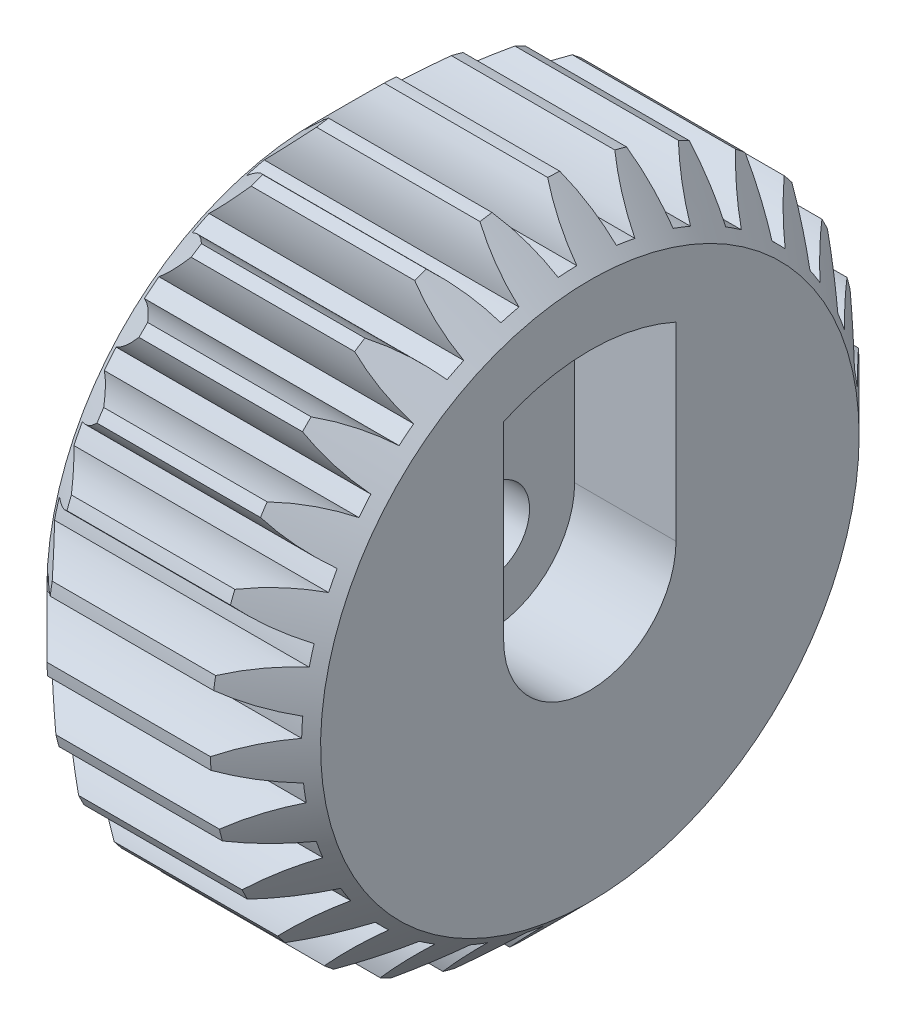
from build123d import *

# Parameters (mm, degrees)
BASPROSKE_W         = 31
BASPROSKE_H         = 22
TOOTHCUT_DEPTH      = 44.920382512
TEETHCUTS_COUNT     = 20
TEETHCUTS_ANGLE     = 342
BORSKE_R            = 10
BORE_DEPTH          = 50.0016256
SKETCH3_R           = 10
BOSS_EXTRUDE2_DEPTH = 31
SKETCH6_R           = 10
SKETCH6_R_2         = 4.05
BOSS_EXTRUDE3_DEPTH = 31
CHAMFER1_SIZE       = 1
CUT_EXTRUDE1_DEPTH  = 12
SKETCH8_R           = 34.56149189
CUT_EXTRUDE2_DEPTH  = 2


with BuildPart() as part:
    # BasProSke → Base-Revolve (revolve)
    with BuildSketch(Plane(origin=(0, 0, 0), x_dir=(1, 0, 0), z_dir=(0, 1, 0)), mode=Mode.PRIVATE) as base_revolve_sk:
        with Locations((-15.5, 11)):
            Rectangle(BASPROSKE_W, BASPROSKE_H)
    revolve(base_revolve_sk.sketch.rotate(Axis((-10, 0, 0), (1, 0, 0)), 180), axis=Axis((-10, 0, 0), (1, 0, 0)))

    # TooCutSke → ToothCut (cut, through all)
    with BuildSketch(Plane(origin=(0, 0, 0), x_dir=(0, 0, -1), z_dir=(1, 0, 0))):
        with BuildLine():
            ThreePointArc((0.986171591, 17.471189616), (0, 17.499), (-0.986171591, 17.471189616))
            ThreePointArc((-0.986171591, 17.471189616), (-1.626916196, 19.798789858), (-2.932850173, 21.829260982))
            ThreePointArc((-2.932850173, 21.829260982), (0, 22.0254), (2.932850173, 21.829260982))
            ThreePointArc((2.932850173, 21.829260982), (1.626916196, 19.798789858), (0.986171591, 17.471189616))
        make_face()
    toothcut = extrude(amount=-TOOTHCUT_DEPTH, mode=Mode.SUBTRACT)

    # TeethCuts: ToothCut ×20 about axis
    teethcuts_axis = Axis((-10, 0, 0), (1, 0, 0))
    for i in range(1, TEETHCUTS_COUNT):
        add(toothcut.rotate(teethcuts_axis, i * TEETHCUTS_ANGLE / (TEETHCUTS_COUNT - 1)), mode=Mode.SUBTRACT)

    # BorSke → Bore (cut, symmetric)
    with BuildSketch(Plane(origin=(0, 0, 0), x_dir=(0, 0, -1), z_dir=(1, 0, 0))):
        with Locations(Location((0, 0, 0), (0, 0, 180))):
            Circle(BORSKE_R)
    extrude(amount=BORE_DEPTH, both=True, mode=Mode.SUBTRACT)

    # Sketch1 → Cut-Revolve1 (revolve, cut)
    with BuildSketch(Plane.XY, mode=Mode.PRIVATE) as cut_revolve1_sk:
        Polygon((-34.236359311, 10.854289206), (-21.762376548, 23.328271968), (-23.45, 29.219589863), (-39.301756289, 29.219589863), (-39.301756289, 14.256333941), align=None)
        Polygon((-38.901756289, 14.656333941), (-31, 14.656333941), (-23.85, 21.806333941), (-23.85, 28.819589863), (-38.901756289, 28.819589863), align=None, mode=Mode.SUBTRACT)
        Polygon((-9.319689583, 23.410338099), (-7.44104044, 29.219589863), (8.301756289, 29.219589863), (8.301756289, 14.256333941), (2.769479507, 11.321169009), align=None)
    revolve(cut_revolve1_sk.sketch.rotate(Axis((0, 0, 0), (1, 0, 0)), 90), axis=Axis((0, 0, 0), (1, 0, 0)), mode=Mode.SUBTRACT)


with BuildPart() as cut_revolve1_kept_piece:
    # of the separate pieces the step leaves, the one the design keeps (cut_revolve1_pieces_kept)
    add(part.part.solids().sort_by_distance((0, 0, 14.090648516))[0])


with BuildPart() as body_2:
    # Sketch3 → Boss-Extrude2 (new body)
    with BuildSketch(Plane.ZY.offset(-2.766830316)):
        with BuildLine():
            ThreePointArc((36.312184516, 64.512291895), (36.403738632, 62.120770133), (36.968058344, 59.794979567))
            ThreePointArc((36.968058344, 59.794979567), (37.562496342, 59.69891248), (38.158636733, 59.61404757))
            ThreePointArc((38.158636733, 59.61404757), (39.388421901, 61.667188319), (40.186312756, 63.923541279))
            ThreePointArc((40.186312756, 63.923541279), (41.103181481, 63.865885398), (42.021464442, 63.83888794))
            ThreePointArc((42.021464442, 63.83888794), (42.608243215, 61.518661838), (43.643790236, 59.361024041))
            ThreePointArc((43.643790236, 59.361024041), (44.245211809, 59.39064686), (44.845969509, 59.431581008))
            ThreePointArc((44.845969509, 59.431581008), (45.622008955, 61.69554242), (45.933341822, 64.06847949))
            ThreePointArc((45.933341822, 64.06847949), (46.842162097, 64.202711256), (47.74599146, 64.36722552))
            ThreePointArc((47.74599146, 64.36722552), (48.80234984, 62.219700092), (50.263865797, 60.32451419))
            ThreePointArc((50.263865797, 60.32451419), (50.845985935, 60.478532255), (51.42510495, 60.643476443))
            ThreePointArc((51.42510495, 60.643476443), (51.713482027, 63.019312539), (51.524650166, 65.405124984))
            ThreePointArc((51.524650166, 65.405124984), (52.385702184, 65.725377824), (53.235576267, 66.074213748))
            ThreePointArc((53.235576267, 66.074213748), (54.715346326, 64.19324616), (56.538955958, 62.643340871))
            ThreePointArc((56.538955958, 62.643340871), (57.076333217, 62.915022853), (57.608503268, 63.196768229))
            ThreePointArc((57.608503268, 63.196768229), (57.396614514, 65.580643572), (56.715870782, 67.875059939))
            ThreePointArc((56.715870782, 67.875059939), (57.491522439, 68.367337267), (58.250297667, 68.885249047))
            ThreePointArc((58.250297667, 68.885249047), (60.088806351, 67.353046608), (62.194809167, 66.21616023))
            ThreePointArc((62.194809167, 66.21616023), (62.663957584, 66.593632324), (63.125920284, 66.979865262))
            ThreePointArc((63.125920284, 66.979865262), (62.423026255, 69.26759306), (61.280122421, 71.370336345))
            ThreePointArc((61.280122421, 71.370336345), (61.936474016, 72.013123279), (62.570988271, 72.677475685))
            ThreePointArc((62.570988271, 72.677475685), (64.687883929, 71.561002994), (66.984237499, 70.886822918))
            ThreePointArc((66.984237499, 70.886822918), (67.364653036, 71.353587782), (67.7362184, 71.827428049))
            ThreePointArc((67.7362184, 71.827428049), (66.573038937, 73.91902362), (65.017925382, 75.73819385))
            ThreePointArc((65.017925382, 75.73819385), (65.526291202, 76.503397518), (66.008813167, 77.285155161))
            ThreePointArc((66.008813167, 77.285155161), (68.3115773, 76.633207433), (70.697919955, 76.451198562))
            ThreePointArc((70.697919955, 76.451198562), (70.972976628, 76.986856332), (71.237905466, 77.527594836))
            ThreePointArc((71.237905466, 77.527594836), (69.665277093, 79.331645416), (67.765919742, 80.787736123))
            ThreePointArc((67.765919742, 80.787736123), (68.104081761, 81.641913452), (68.413522909, 82.506909773))
            ThreePointArc((68.413522909, 82.506909773), (70.801513676, 82.347980252), (73.17355079, 82.666097247))
            ThreePointArc((73.17355079, 82.666097247), (73.331227302, 83.247237107), (73.477940953, 83.83124098))
            ThreePointArc((73.477940953, 83.83124098), (71.564595077, 85.268900903), (69.40400496, 86.298273936))
            ThreePointArc((69.40400496, 86.298273936), (69.557183874, 87.204093278), (69.680020144, 88.114523786))
            ThreePointArc((69.680020144, 88.114523786), (72.048870889, 88.455558454), (74.302933058, 89.259898078))
            ThreePointArc((74.302933058, 89.259898078), (74.336338189, 89.861121427), (74.358424562, 90.462866898))
            ThreePointArc((74.358424562, 90.462866898), (72.187983579, 91.471303526), (69.860588852, 92.028970344))
            ThreePointArc((69.860588852, 92.028970344), (69.822090009, 92.946843047), (69.752952865, 93.862917561))
            ThreePointArc((69.752952865, 93.862917561), (71.999133443, 94.689011567), (74.036707335, 95.944420317))
            ThreePointArc((74.036707335, 95.944420317), (73.94438112, 96.539450811), (73.840874934, 97.132638714))
            ThreePointArc((73.840874934, 97.132638714), (71.50819753, 97.667778527), (69.11571651, 97.729366415))
            ThreePointArc((69.11571651, 97.729366415), (68.887222494, 98.619177038), (68.629133561, 99.500858705))
            ThreePointArc((68.629133561, 99.500858705), (70.654475103, 100.775907777), (72.386508961, 102.427518266))
            ThreePointArc((72.386508961, 102.427518266), (72.172486499, 102.990350217), (71.947911472, 103.549055395))
            ThreePointArc((71.947911472, 103.549055395), (69.554946842, 103.587510216), (67.201942431, 103.150327487))
            ThreePointArc((67.201942431, 103.150327487), (66.793439526, 103.973187035), (66.35767853, 104.781942136))
            ThreePointArc((66.35767853, 104.781942136), (68.073663891, 106.450220511), (69.424459524, 108.425849437))
            ThreePointArc((69.424459524, 108.425849437), (69.098094624, 108.931884387), (68.762265762, 109.431688743))
            ThreePointArc((68.762265762, 109.431688743), (66.413597944, 108.971777912), (64.202907725, 108.054931549))
            ThreePointArc((64.202907725, 108.054931549), (63.632249469, 108.774877112), (63.037861255, 109.475359168))
            ThreePointArc((63.037861255, 109.475359168), (64.369493641, 111.463955075), (65.280014799, 113.677257973))
            ThreePointArc((65.280014799, 113.677257973), (64.855571173, 114.104379768), (64.423165808, 114.523439453))
            ThreePointArc((64.423165808, 114.523439453), (62.221442855, 113.585263279), (60.2496846, 112.228823868))
            ThreePointArc((60.2496846, 112.228823868), (59.541811496, 112.81439037), (58.814773682, 113.375984954))
            ThreePointArc((58.814773682, 113.375984954), (59.703854368, 115.59798721), (60.134306906, 117.952232123))
            ThreePointArc((60.134306906, 117.952232123), (59.630334777, 118.28177349), (59.1202511, 118.601773585))
            ThreePointArc((59.1202511, 118.601773585), (57.16169887, 117.22633487), (55.515047875, 115.489585321))
            ThreePointArc((55.515047875, 115.489585321), (54.700897375, 115.915180696), (53.872985003, 116.31334343))
            ThreePointArc((53.872985003, 116.31334343), (54.280656896, 118.671639875), (54.212227973, 121.063935002))
            ThreePointArc((54.212227973, 121.063935002), (53.650753342, 121.281493402), (53.085284456, 121.488448367))
            ThreePointArc((53.085284456, 121.488448367), (51.45550108, 119.735860383), (50.205923895, 117.694704986))
            ThreePointArc((50.205923895, 117.694704986), (49.321078283, 117.941728674), (48.428475095, 118.159057936))
            ThreePointArc((48.428475095, 118.159057936), (48.336920979, 120.550579698), (47.772601267, 122.876370264))
            ThreePointArc((47.772601267, 122.876370264), (47.178163268, 122.972437351), (46.582022877, 123.057302261))
            ThreePointArc((46.582022877, 123.057302261), (45.35223771, 121.004161512), (44.554346854, 118.747808552))
            ThreePointArc((44.554346854, 118.747808552), (43.637478129, 118.805464433), (42.719195168, 118.832461891))
            ThreePointArc((42.719195168, 118.832461891), (42.132416396, 121.152687993), (41.096869374, 123.31032579))
            ThreePointArc((41.096869374, 123.31032579), (40.495447802, 123.280702971), (39.894690102, 123.239768823))
            ThreePointArc((39.894690102, 123.239768823), (39.118650656, 120.975807411), (38.807317789, 118.602870341))
            ThreePointArc((38.807317789, 118.602870341), (37.898497513, 118.468638575), (36.994668151, 118.304124311))
            ThreePointArc((36.994668151, 118.304124311), (35.93830977, 120.451649739), (34.476793813, 122.346835641))
            ThreePointArc((34.476793813, 122.346835641), (33.894673676, 122.192817576), (33.315554661, 122.027873388))
            ThreePointArc((33.315554661, 122.027873388), (33.027177584, 119.652037292), (33.216009445, 117.266224847))
            ThreePointArc((33.216009445, 117.266224847), (32.354957427, 116.945972007), (31.505083343, 116.597136083))
            ThreePointArc((31.505083343, 116.597136083), (30.025313285, 118.478103672), (28.201703653, 120.028008961))
            ThreePointArc((28.201703653, 120.028008961), (27.664326393, 119.756326978), (27.132156343, 119.474581602))
            ThreePointArc((27.132156343, 119.474581602), (27.344045097, 117.090706259), (28.024788828, 114.796289892))
            ThreePointArc((28.024788828, 114.796289892), (27.249137172, 114.304012564), (26.490361943, 113.786100785))
            ThreePointArc((26.490361943, 113.786100785), (24.651853259, 115.318303223), (22.545850444, 116.455189601))
            ThreePointArc((22.545850444, 116.455189601), (22.076702027, 116.077717507), (21.614739327, 115.691484569))
            ThreePointArc((21.614739327, 115.691484569), (22.317633356, 113.403756771), (23.46053719, 111.301013486))
            ThreePointArc((23.46053719, 111.301013486), (22.804185595, 110.658226552), (22.169671339, 109.993874146))
            ThreePointArc((22.169671339, 109.993874146), (20.052775681, 111.110346837), (17.756422111, 111.784526913))
            ThreePointArc((17.756422111, 111.784526913), (17.376006574, 111.317762049), (17.00444121, 110.843921782))
            ThreePointArc((17.00444121, 110.843921782), (18.167620674, 108.752326211), (19.722734228, 106.933155981))
            ThreePointArc((19.722734228, 106.933155981), (19.214368409, 106.167952313), (18.731846444, 105.38619467))
            ThreePointArc((18.731846444, 105.38619467), (16.42908231, 106.038142398), (14.042739656, 106.220151269))
            ThreePointArc((14.042739656, 106.220151269), (13.767682983, 105.684493499), (13.502754145, 105.143754995))
            ThreePointArc((13.502754145, 105.143754995), (15.075382518, 103.339704415), (16.974739869, 101.883613708))
            ThreePointArc((16.974739869, 101.883613708), (16.63657785, 101.029436379), (16.327136701, 100.164440058))
            ThreePointArc((16.327136701, 100.164440058), (13.939145935, 100.323369579), (11.56710882, 100.005252584))
            ThreePointArc((11.56710882, 100.005252584), (11.409432308, 99.424112724), (11.262718658, 98.840108851))
            ThreePointArc((11.262718658, 98.840108851), (13.176064534, 97.402448928), (15.336654651, 96.373075895))
            ThreePointArc((15.336654651, 96.373075895), (15.183475736, 95.467256553), (15.060639467, 94.556826045))
            ThreePointArc((15.060639467, 94.556826045), (12.691788722, 94.215791377), (10.437726552, 93.411451753))
            ThreePointArc((10.437726552, 93.411451753), (10.404321421, 92.810228404), (10.382235049, 92.208482933))
            ThreePointArc((10.382235049, 92.208482933), (12.552676032, 91.200046305), (14.880070759, 90.642379487))
            ThreePointArc((14.880070759, 90.642379487), (14.918569602, 89.724506784), (14.987706746, 88.80843227))
            ThreePointArc((14.987706746, 88.80843227), (12.741526168, 87.982338264), (10.703952276, 86.726929515))
            ThreePointArc((10.703952276, 86.726929515), (10.796278491, 86.13189902), (10.899784676, 85.538711117))
            ThreePointArc((10.899784676, 85.538711117), (13.232462081, 85.003571304), (15.6249431, 84.941983416))
            ThreePointArc((15.6249431, 84.941983416), (15.853437117, 84.052172794), (16.11152605, 83.170491126))
            ThreePointArc((16.11152605, 83.170491126), (14.086184508, 81.895442054), (12.35415065, 80.243831565))
            ThreePointArc((12.35415065, 80.243831565), (12.568173111, 79.680999614), (12.792748139, 79.122294436))
            ThreePointArc((12.792748139, 79.122294436), (15.185712769, 79.083839615), (17.538717179, 79.521022344))
            ThreePointArc((17.538717179, 79.521022344), (17.947220085, 78.698162796), (18.382981081, 77.889407695))
            ThreePointArc((18.382981081, 77.889407695), (16.66699572, 76.22112932), (15.316200087, 74.245500394))
            ThreePointArc((15.316200087, 74.245500394), (15.642564986, 73.739465444), (15.978393849, 73.239661088))
            ThreePointArc((15.978393849, 73.239661088), (18.327061667, 73.699571919), (20.537751885, 74.616418282))
            ThreePointArc((20.537751885, 74.616418282), (21.108410142, 73.896472719), (21.702798356, 73.195990663))
            ThreePointArc((21.702798356, 73.195990663), (20.37116597, 71.207394756), (19.460644812, 68.994091858))
            ThreePointArc((19.460644812, 68.994091858), (19.885088438, 68.566970063), (20.317493802, 68.147910378))
            ThreePointArc((20.317493802, 68.147910378), (22.519216756, 69.086086552), (24.490975011, 70.442525963))
            ThreePointArc((24.490975011, 70.442525963), (25.198848115, 69.856959462), (25.925885929, 69.295364877))
            ThreePointArc((25.925885929, 69.295364877), (25.036805242, 67.073362621), (24.606352705, 64.719117708))
            ThreePointArc((24.606352705, 64.719117708), (25.110324833, 64.389576341), (25.620408511, 64.069576246))
            ThreePointArc((25.620408511, 64.069576246), (27.57896074, 65.445014962), (29.225611736, 67.18176451))
            ThreePointArc((29.225611736, 67.18176451), (30.039762235, 66.756169135), (30.867674608, 66.358006401))
            ThreePointArc((30.867674608, 66.358006401), (30.460002714, 63.999709956), (30.528431638, 61.607414829))
            ThreePointArc((30.528431638, 61.607414829), (31.089906269, 61.389856429), (31.655375155, 61.182901464))
            ThreePointArc((31.655375155, 61.182901464), (33.28515853, 62.935489448), (34.534735715, 64.976644845))
            ThreePointArc((34.534735715, 64.976644845), (35.419581327, 64.729621157), (36.312184516, 64.512291895))
        make_face()
        with Locations((42.370329805, 91.335674916)):
            Circle(SKETCH3_R, mode=Mode.SUBTRACT)
    extrude(amount=BOSS_EXTRUDE2_DEPTH)

    # Sketch5 → Cut-Revolve2 (revolve, cut)
    with BuildSketch(Plane(origin=(0, 93.09207977, 4.294225582), x_dir=(0, 0.04607979650460585, -0.9989377620022653), z_dir=(0, 0.9989377620022653, 0.04607979650460585)), mode=Mode.PRIVATE) as cut_revolve2_sk:
        Polygon((-73.260154024, 31.110548745), (-73.260154024, 17.651100668), (-59.800705947, 31.110548745), align=None)
        Polygon((-59.800705947, -5.644209376), (-73.260154024, -5.644209376), (-73.260154024, 7.8152387), align=None)
    revolve(cut_revolve2_sk.sketch.rotate(Axis((2.766830316, 91.335674916, 42.370329805), (1, 0, 0)), 357.35888691), axis=Axis((2.766830316, 91.335674916, 42.370329805), (1, 0, 0)), mode=Mode.SUBTRACT)

    # Sketch6 → Boss-Extrude3 (add)
    with BuildSketch(Plane.ZY.offset(28.233169684)):
        with Locations((42.370329805, 91.335674916)):
            Circle(SKETCH6_R)
        with Locations((42.370329805, 91.335674916)):
            Circle(SKETCH6_R_2, mode=Mode.SUBTRACT)
    extrude(amount=-BOSS_EXTRUDE3_DEPTH)

    # Chamfer1
    chamfer1_edges = [body_2.edges().sort_by_distance(p)[0] for p in [
        (2.766830316, 91.335674916, 38.320329805),
        (-28.233169684, 91.335674916, 38.320329805),
    ]]
    chamfer(chamfer1_edges, length=CHAMFER1_SIZE)

    # Sketch7 → Cut-Extrude1 (cut)
    with BuildSketch(Plane(origin=(2.766830316, 0, 0), x_dir=(0, 0, -1), z_dir=(1, 0, 0))):
        with BuildLine():
            Line((-50.870329805, 91.335674916), (-50.870329805, 110.057986438))
            ThreePointArc((-50.870329805, 110.057986438), (-42.370329805, 111.897166806), (-33.870329805, 110.057986438))
            Line((-33.870329805, 110.057986438), (-33.870329805, 91.335674916))
            ThreePointArc((-33.870329805, 91.335674916), (-42.370329805, 82.835674916), (-50.870329805, 91.335674916))
        make_face()
    cut_extrude1 = extrude(amount=-CUT_EXTRUDE1_DEPTH, mode=Mode.SUBTRACT)

    # Sketch8 → Cut-Extrude2 (cut)
    with BuildSketch(Plane(origin=(2.766830316, 0, 0), x_dir=(0, 0, -1), z_dir=(1, 0, 0))):
        with Locations((-42.370329805, 91.335674916)):
            Circle(SKETCH8_R)
    cut_extrude2 = extrude(amount=-CUT_EXTRUDE2_DEPTH, mode=Mode.SUBTRACT)

    # Mirror1: Cut-Extrude1, Cut-Extrude2 across plane
    add(cut_extrude1.mirror(Plane(origin=(-12.733169684, 0, 0), x_dir=(0, 0, 1), z_dir=(1, 0, 0))), mode=Mode.SUBTRACT)
    add(cut_extrude2.mirror(Plane(origin=(-12.733169684, 0, 0), x_dir=(0, 0, 1), z_dir=(1, 0, 0))), mode=Mode.SUBTRACT)


solid = body_2.part
